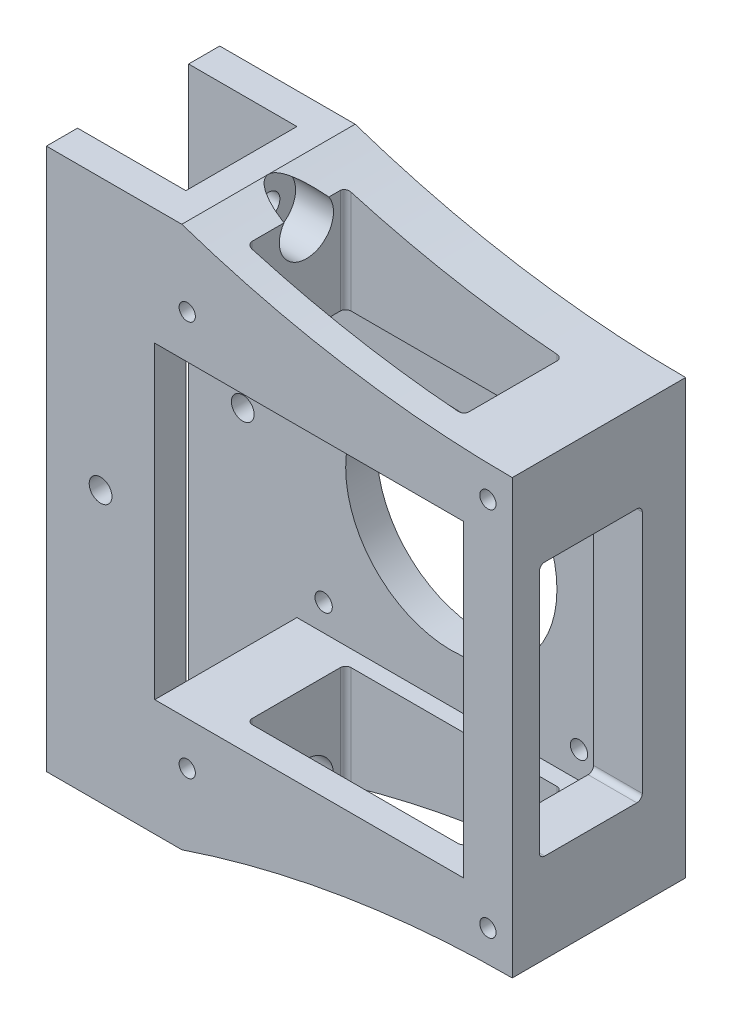
from build123d import *
from build123d.topology import SkipClean

# Parameters (mm, degrees)
EXTRUDE_1_DEPTH           = 52
CUT_EXTRUDE_1_DEPTH       = 113.24972160321826
CUT_EXTRUDE_2_DEPTH       = 20
CUT_EXTRUDE_3_DEPTH       = 10
CUT_EXTRUDE_START         = -10
CUT_EXTRUDE_4_DEPTH       = 10
EXTRUDE_2_DEPTH           = 5.75
SKETCH_7_R                = 19.499999999999996
CUT_EXTRUDE_5_DEPTH       = 103.88373292216811
SKETCH_8_R                = 2.1
CUT_EXTRUDE_6_DEPTH       = 93.84395510748136
CUT_EXTRUDE_START_2       = -61.0000001
CUT_EXTRUDE_7_OUTLINE_R   = 5
CUT_EXTRUDE_7_OUTLINE_R_2 = 2.1
CUT_EXTRUDE_7_DEPTH       = 61.0000001
SKETCH_12_R               = 2.099999999999999
CUT_EXTRUDE_8_DEPTH       = 105.49880398167254
SKETCH_14_R               = 1.600000000000005
CUT_EXTRUDE_9_DEPTH       = 5.75
CUT_EXTRUDE_10_DEPTH      = 9
CUT_EXTRUDE1_DEPTH        = 124.78307655451134
CUT_EXTRUDE1_DEPTH_BACK   = 124.78307655451134
FILLET_1_R                = 1
FILLET_2_R                = 1
FILLET_3_R                = 1
EXTRUDE_START             = -32
EXTRUDE_3_DEPTH           = 32
EXTRUDE_4_DEPTH           = 32
SKETCH_18_R               = 1.4999999999999973
SKETCH_18_R_2             = 1.5000000000000009
CUT_EXTRUDE_11_DEPTH      = 15


# Read off the part's stored shape, not the designer's step: Вырез-Вытянуть7
with BuildPart() as part:
    # Эскиз1 → Бобышка-Вытянуть1 (new body)
    with BuildSketch(Plane.XY):
        with BuildLine():
            Line((0, -50), (0, 50))
            Line((0, 50), (25, 50))
            ThreePointArc((25, 50), (55.092881078948835, 42.516574581587776), (86, 40))
            Line((86, 40), (86, -40))
            ThreePointArc((86, -40), (55.09288107894883, -42.516574581587776), (25, -50))
            Line((25, -50), (0, -50))
        make_face()
    extrude(amount=EXTRUDE_1_DEPTH)

    # Эскиз2 → Вырез-Вытянуть1 (cut, through all)
    with BuildSketch(Plane.XY.offset(52)):
        Polygon((77, 28.5), (77.00000000000001, -28.5), (20.000000000000004, -28.50000000000001), (19.999999999999996, 28.499999999999996), align=None)
    extrude(amount=-CUT_EXTRUDE_1_DEPTH, mode=Mode.SUBTRACT)

    # Эскиз3 → Вырез-Вытянуть2 (cut)
    with BuildSketch(Plane.ZY):
        Polygon((15.75, 50), (36.25, 50), (36.25000000000001, -50), (15.74999999999999, -50), align=None)
    extrude(amount=-CUT_EXTRUDE_2_DEPTH, mode=Mode.SUBTRACT)

    # Эскиз4 → Вырез-Вытянуть3 (cut)
    with BuildSketch(Plane(origin=(0, 0, 0), x_dir=(-1, 0, 0), z_dir=(0, 0, -1))):
        with BuildLine():
            Line((0, 50), (-24.999999999999968, 50.00000000000003))
            ThreePointArc((-24.999999999999968, 50.00000000000003), (-55.092881078948814, 42.516574581587804), (-86.00000000000003, 40.00000000000001))
            Line((-86.00000000000003, 40.00000000000001), (-85.99999999999999, -39.99999999999998))
            ThreePointArc((-85.99999999999999, -39.99999999999998), (-55.09288107894881, -42.516574581587776), (-24.999999999999993, -50))
            Line((-24.999999999999993, -50), (0, -50))
            Line((0, -50), (0, 50))
        make_face()
    extrude(amount=-CUT_EXTRUDE_3_DEPTH, mode=Mode.SUBTRACT)

    # Эскиз5 → Вырез-Вытянуть4 (cut)
    with BuildSketch(Plane.XY.offset(52).offset(CUT_EXTRUDE_START)):
        with BuildLine():
            Line((24.999999999999968, 50.00000000000003), (0, 50))
            Line((0, 50), (0, -50))
            Line((0, -50), (25, -50))
            ThreePointArc((25, -50), (55.09288107894883, -42.516574581587776), (85.99999999999997, -39.99999999999998))
            Line((85.99999999999997, -39.99999999999998), (86, 40))
            ThreePointArc((86, 40), (55.092881078948835, 42.516574581587804), (24.999999999999968, 50.00000000000003))
        make_face()
    extrude(amount=CUT_EXTRUDE_4_DEPTH, mode=Mode.SUBTRACT)

    # Эскиз6 → Бобышка-Вытянуть2 (add)
    with BuildSketch(Plane(origin=(0, 0, 10), x_dir=(-1, 0, 0), z_dir=(0, 0, -1))):
        Polygon((-20.000000000000004, -28.50000000000001), (-77.00000000000001, -28.5), (-77, 28.5), (-19.999999999999996, 28.499999999999996), align=None)
    extrude(amount=-EXTRUDE_2_DEPTH)

    # Эскиз7 → Вырез-Вытянуть5 (cut, through all)
    with BuildSketch(Plane.XY.offset(15.749999999999993)):
        with Locations((48.50000000000001, 0)):
            Circle(SKETCH_7_R)
    extrude(amount=-CUT_EXTRUDE_5_DEPTH, mode=Mode.SUBTRACT)

    # Эскиз8 → Вырез-Вытянуть6 (cut, through all)
    with BuildSketch(Plane.ZY.offset(-20)):
        with Locations((26, -45.00000000000001)):
            Circle(SKETCH_8_R)
        with Locations((26, 45)):
            Circle(SKETCH_8_R)
    extrude(amount=-CUT_EXTRUDE_6_DEPTH, mode=Mode.SUBTRACT)

    # Вырез-Вытянуть7 outline → Вырез-Вытянуть7 (cut)
    # profile 1 of 2: a face of its own
    with BuildSketch(Plane.ZY.offset(-25).offset(CUT_EXTRUDE_START_2)):
        with Locations((26, 45)):
            Circle(CUT_EXTRUDE_7_OUTLINE_R)
        with Locations((26, 45)):
            Circle(CUT_EXTRUDE_7_OUTLINE_R_2, mode=Mode.SUBTRACT)
    # profile 2 of 2: a face of its own
    with BuildSketch(Plane.ZY.offset(-25).offset(CUT_EXTRUDE_START_2)):
        with Locations((26, -45)):
            Circle(CUT_EXTRUDE_7_OUTLINE_R)
        with Locations((26, -45)):
            Circle(CUT_EXTRUDE_7_OUTLINE_R_2, mode=Mode.SUBTRACT)
    extrude(amount=CUT_EXTRUDE_7_DEPTH, mode=Mode.SUBTRACT)

    # Эскиз12 → Вырез-Вытянуть8 (cut, through all)
    with BuildSketch(Plane(origin=(0, 0, 10), x_dir=(-1, 0, 0), z_dir=(0, 0, -1))):
        with Locations((-10, 0)):
            Circle(SKETCH_12_R)
    extrude(amount=-CUT_EXTRUDE_8_DEPTH, mode=Mode.SUBTRACT)

    # Эскиз14 → Вырез-Вытянуть9 (cut)
    with BuildSketch(Plane(origin=(0, 0, 10), x_dir=(-1, 0, 0), z_dir=(0, 0, -1))):
        with Locations((-72.07000000000002, 23.569999999999993)):
            Circle(SKETCH_14_R)
        with Locations((-24.930000000000014, 23.57)):
            Circle(SKETCH_14_R)
        with Locations((-24.930000000000007, -23.57)):
            Circle(SKETCH_14_R)
        with Locations((-72.07000000000001, -23.570000000000007)):
            Circle(SKETCH_14_R)
    extrude(amount=-CUT_EXTRUDE_9_DEPTH, mode=Mode.SUBTRACT)

    # Эскиз15 → Вырез-Вытянуть10 (cut)
    with BuildSketch(Plane(origin=(86, 0, 0), x_dir=(0, 0, -1), z_dir=(1, 0, 0))):
        Polygon((-37, 23.499999999999996), (-18.000000000000004, 23.499999999999996), (-18, -23.500000000000004), (-37, -23.500000000000004), align=None)
    extrude(amount=-CUT_EXTRUDE_10_DEPTH, mode=Mode.SUBTRACT)

    # Sketch1 → Cut-Extrude1 (cut, two sides: drawn at the far end of the back side and taken through both)
    with BuildSketch(Plane.XZ.offset(-28.499999999999996).offset(-CUT_EXTRUDE1_DEPTH_BACK)):
        Polygon((72, 37), (72, 18.749999999999986), (31.999999999999993, 18.74999999999998), (31.999999999999986, 36.99999999999999), align=None)
    extrude(amount=CUT_EXTRUDE1_DEPTH + CUT_EXTRUDE1_DEPTH_BACK, mode=Mode.SUBTRACT)

    # Скругление1
    fillet_1_edges = [part.edges().sort_by_distance(p)[0] for p in [
        (81.5, -23.500000000000004, 37),
        (81.5, 23.499999999999996, 37),
        (81.5, 23.499999999999996, 18.000000000000004),
        (81.5, -23.500000000000004, 18),
    ]]
    fillet(fillet_1_edges, radius=FILLET_1_R)

    # Скругление2
    fillet_2_edges = [part.edges().sort_by_distance(p)[0] for p in [
        (31.999999999999986, 38.145170659331654, 36.99999999999999),
        (71.99999999999999, 34.50682260061859, 18.749999999999986),
        (71.99999999999999, 34.506822600618605, 37),
        (31.999999999999993, 38.14517065933167, 18.74999999999998),
    ]]
    fillet(fillet_2_edges, radius=FILLET_2_R)

    # Скругление3
    fillet_3_edges = [part.edges().sort_by_distance(p)[0] for p in [
        (31.999999999999996, -38.14517065933168, 36.99999999999999),
        (72, -34.50682260061862, 18.749999999999986),
        (72, -34.50682260061859, 37),
        (32.00000000000001, -38.14517065933168, 18.74999999999998),
    ]]
    fillet(fillet_3_edges, radius=FILLET_3_R)

    # Эскиз16 → Бобышка-Вытянуть3 (add)
    with BuildSketch(Plane.XY.offset(41.99999999999999).offset(EXTRUDE_START)):
        with BuildLine():
            Line((72, 40.51364520123729), (72, 28.5))
            Line((72, 28.5), (86, 28.499999999999996))
            Line((86, 28.499999999999996), (86, 40))
            ThreePointArc((86, 40), (78.99529030949971, 40.12845448417352), (72, 40.51364520123729))
        make_face()
    extrude(amount=EXTRUDE_3_DEPTH)

    # Эскиз17 → Бобышка-Вытянуть4 (add)
    with SkipClean():  # the faces are left unmerged after this step: merging them gives an invalid solid
        with BuildSketch(Plane.XY.offset(41.99999999999999).offset(EXTRUDE_START)):
            with BuildLine():
                Line((85.99999999999997, -39.99999999999998), (85.99999999999997, -28.5))
                Line((85.99999999999997, -28.5), (72.00000000000001, -28.5))
                Line((72.00000000000001, -28.5), (72.00000000000001, -40.51364520123727))
                ThreePointArc((72.00000000000001, -40.51364520123727), (78.99529030949971, -40.12845448417346), (85.99999999999997, -39.99999999999998))
            make_face()
        extrude(amount=EXTRUDE_4_DEPTH)

    # Эскиз18 → Вырез-Вытянуть11 (cut)
    with SkipClean():  # the faces are left unmerged after this step: merging them gives an invalid solid
        with BuildSketch(Plane.XY.offset(41.99999999999999)):
            with Locations((81.49999999999999, 34.25)):
                Circle(SKETCH_18_R)
            with Locations((25.999999999999996, 36.5)):
                Circle(SKETCH_18_R_2)
            with Locations(Location((81.49999999999999, -34.25, 0), (0, 0, 180))):
                Circle(SKETCH_18_R)
            with Locations(Location((25.999999999999996, -36.5, 0), (0, 0, 180))):
                Circle(SKETCH_18_R_2)
        extrude(amount=-CUT_EXTRUDE_11_DEPTH, mode=Mode.SUBTRACT)


solid = part.part
